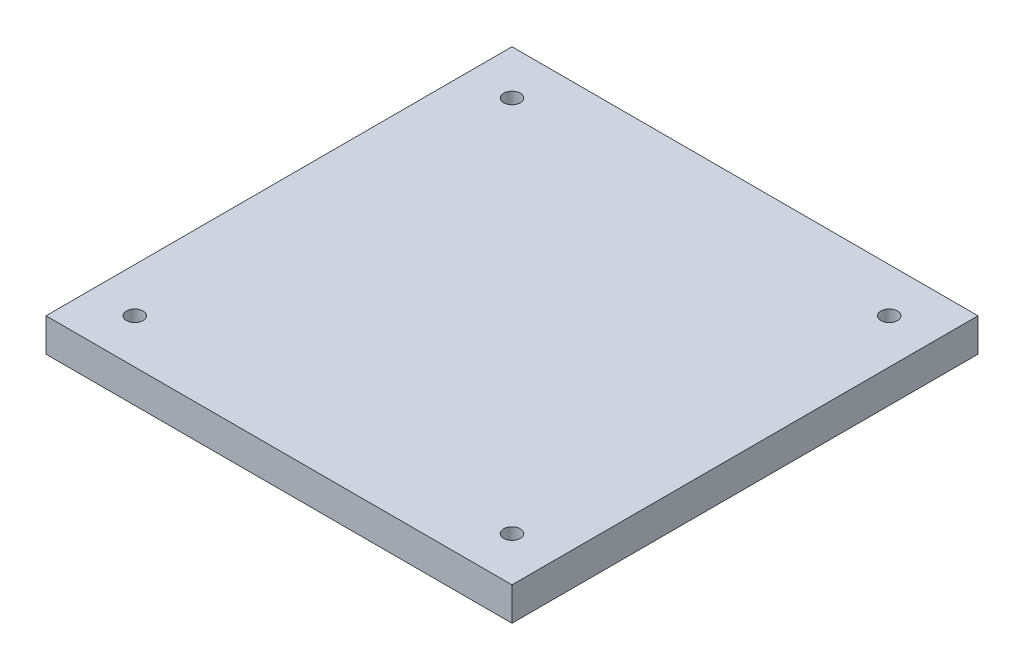
from build123d import *

# Parameters (mm, degrees)
SKETCH1_W            = 84
SKETCH1_H            = 84
BOSS_EXTRUDE1_DEPTH  = 6
SKETCH2_R            = 1.5
CUT_EXTRUDE1_DEPTH   = 6
LPATTERN1_COUNT      = 2
LPATTERN1_PITCH      = 68
LPATTERN1_COUNT_DIR2 = 2
LPATTERN1_PITCH_DIR2 = 68


with BuildPart() as part:
    # Sketch1 → Boss-Extrude1 (new body)
    with BuildSketch(Plane(origin=(0, 0, 0), x_dir=(1, 0, 0), z_dir=(0, 1, 0))):
        with Locations((42, 42)):
            Rectangle(SKETCH1_W, SKETCH1_H)
    extrude(amount=BOSS_EXTRUDE1_DEPTH)

    # Sketch2 → Cut-Extrude1 (cut)
    with BuildSketch(Plane(origin=(0, 6, 0), x_dir=(1, 0, 0), z_dir=(0, 1, 0))):
        with Locations((8, 76)):
            Circle(SKETCH2_R)
    cut_extrude1 = extrude(amount=-CUT_EXTRUDE1_DEPTH, mode=Mode.SUBTRACT)

    # LPattern1: Cut-Extrude1 2 × 2
    with Locations(*[(i * LPATTERN1_PITCH, 0, j * LPATTERN1_PITCH_DIR2) for i in range(LPATTERN1_COUNT) for j in range(LPATTERN1_COUNT_DIR2) if (i, j) != (0, 0)]):
        add(cut_extrude1, mode=Mode.SUBTRACT)


solid = part.part
